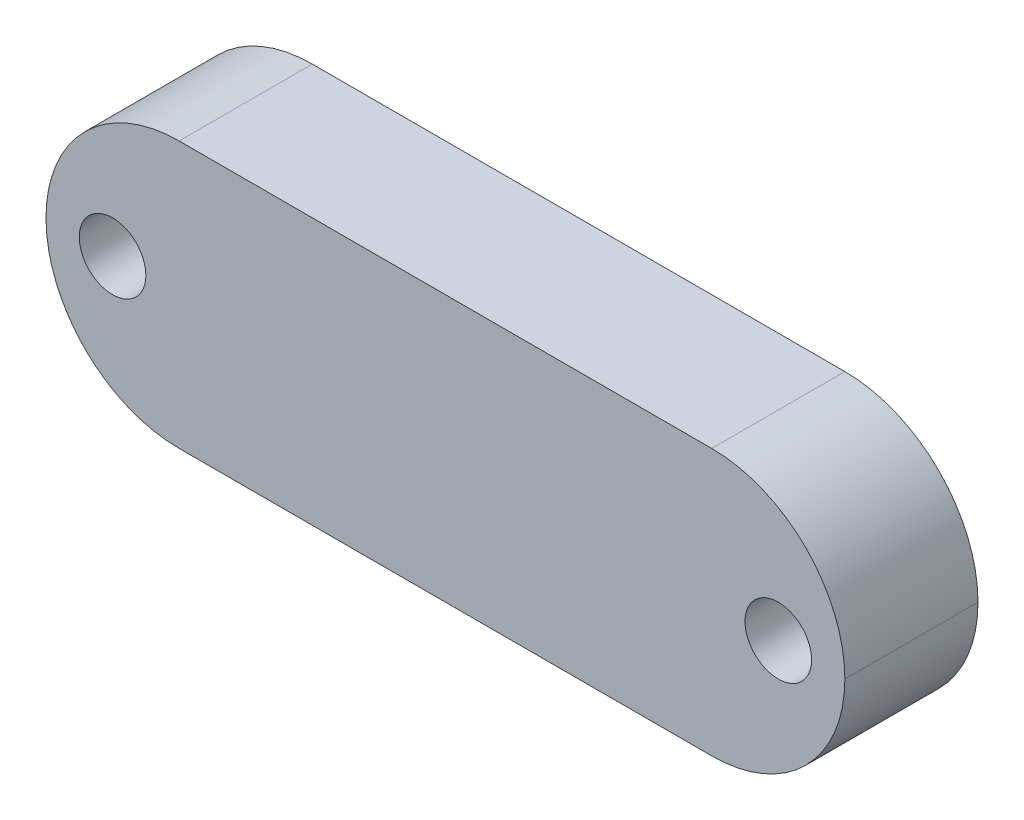
from build123d import *

# Parameters (mm, degrees)
SKETCH1_W           = 60
SKETCH1_H           = 20
SKETCH1_R           = 2.5
BOSS_EXTRUDE1_DEPTH = 10
FILLET1_R           = 10


with BuildPart() as part:
    # Sketch1 → Boss-Extrude1 (new body)
    with BuildSketch(Plane.XY):
        Rectangle(SKETCH1_W, SKETCH1_H)
        with Locations((-25, 0)):
            Circle(SKETCH1_R, mode=Mode.SUBTRACT)
        with Locations((25, 0)):
            Circle(SKETCH1_R, mode=Mode.SUBTRACT)
    extrude(amount=BOSS_EXTRUDE1_DEPTH)

    # Fillet1
    fillet1_edges = [part.edges().sort_by_distance(p)[0] for p in [
        (30, -10, 5),
        (30, 10, 5),
        (-30, -10, 5),
        (-30, 10, 5),
    ]]
    fillet(fillet1_edges, radius=FILLET1_R - 0.0001)  # a hair under: the kernel refuses the full size


solid = part.part
